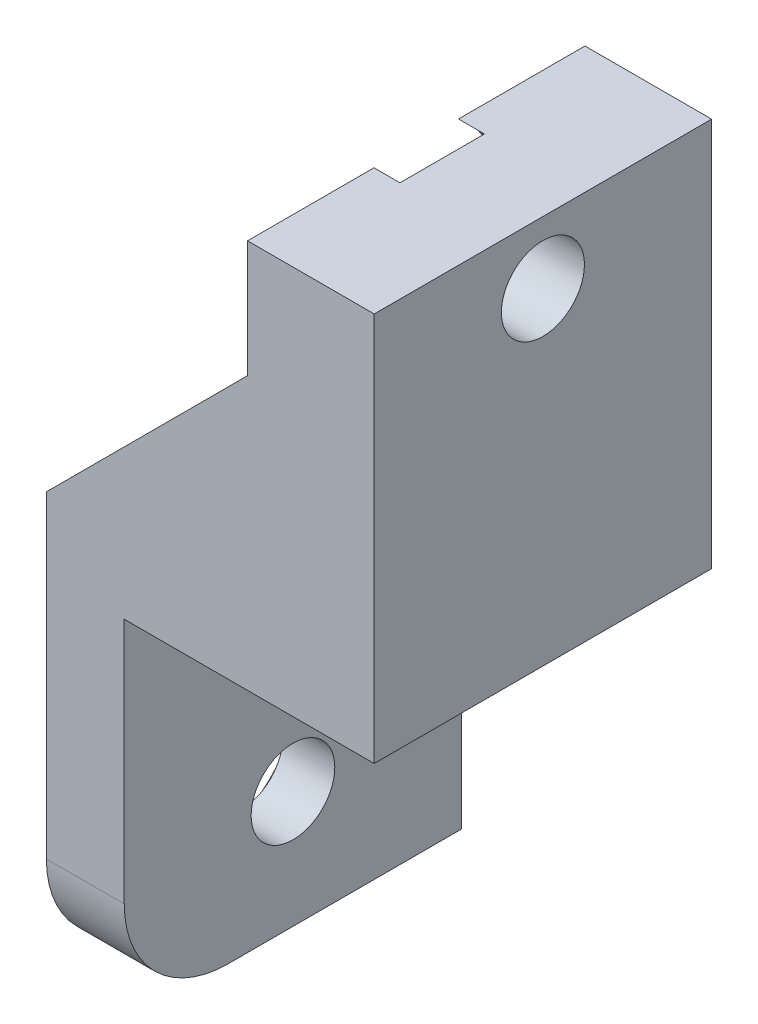
from build123d import *

# Parameters (mm, degrees)
BOSS_EXTRUDE1_DEPTH     = 13
CUT_EXTRUDE1_DEPTH      = 10
CUT_EXTRUDE1_DEPTH_BACK = 30
SKETCH2_R               = 1.6
SKETCH2_R_2             = 1.611537585
SKETCH3_R               = 3
CUT_EXTRUDE2_DEPTH      = 1
SKETCH4_R               = 2.9
CUT_EXTRUDE3_DEPTH      = 1
CHAMFER1_SIZE           = 10
FILLET1_R               = 4


with BuildPart() as part:
    # Sketch1 → Boss-Extrude1 (new body)
    with BuildSketch(Plane.XY.offset(98.171636097)):
        Polygon((30.334370899, 78.263460463), (35.214370899, 78.263460463), (35.214370899, 65.863460463), (35.214370899, 63.263460463), (25.584370899, 63.263460463), (25.584370899, 49.763460463), (22.584370899, 49.763460463), (22.584370899, 63.263460463), (22.584370899, 63.763460463), (30.334370899, 63.763460463), align=None)
    extrude(amount=-BOSS_EXTRUDE1_DEPTH)

    # Sketch2 → Cut-Extrude1 (cut, two sides: drawn at the far end of the back side and taken through both)
    with BuildSketch(Plane(origin=(35.214370899, 0, 0), x_dir=(0, 0, -1), z_dir=(1, 0, 0)).offset(-CUT_EXTRUDE1_DEPTH_BACK)):
        with Locations(Location((-91.671636097, 75.863460463, 0), (0, 0, 180))):
            Circle(SKETCH2_R)
        with Locations(Location((-91.671636097, 54.263460463, 0), (0, 0, 180))):
            Circle(SKETCH2_R_2)
    extrude(amount=CUT_EXTRUDE1_DEPTH + CUT_EXTRUDE1_DEPTH_BACK, mode=Mode.SUBTRACT)

    # Sketch3 → Cut-Extrude2 (cut)
    with BuildSketch(Plane.ZY.offset(-22.584370899)):
        with Locations((91.671636097, 54.263460463)):
            Circle(SKETCH3_R)
    extrude(amount=-CUT_EXTRUDE2_DEPTH, mode=Mode.SUBTRACT)

    # Sketch4 → Cut-Extrude3 (cut)
    with BuildSketch(Plane.ZY.offset(-30.334370899)):
        with Locations((91.671636097, 75.863460463)):
            Circle(SKETCH4_R)
    extrude(amount=-CUT_EXTRUDE3_DEPTH, mode=Mode.SUBTRACT)

    # Chamfer1
    # the kernel refuses this chamfer: 10 mm, written as the material it adds along each edge
    with BuildSketch(Plane(origin=(30.334370899, 63.763460463, 98.171636097), x_dir=(0.027495876610586337, 0.9996219169112968, 0), z_dir=(0, 0, -1))) as chamfer1_piece_1_section:
        Polygon((CHAMFER1_SIZE * 0.999621916911, -CHAMFER1_SIZE * 0.0274958766106), (-CHAMFER1_SIZE * 0.0274958766106, -CHAMFER1_SIZE * 0.999621916911), (0, 0), align=None)
    chamfer1_piece_1 = extrude(amount=13, mode=Mode.PRIVATE)
    chamfer1_piece_1 = chamfer1_piece_1 - Plane(origin=(27.388550815, 75.863460463, 91.671636097), x_dir=(0, 0, 1), z_dir=(-1, 0, 0)) * Cylinder(2.9, 66, mode=Mode.PRIVATE)
    chamfer1_piece_1 = split(chamfer1_piece_1, bisect_by=Plane(origin=(22.584370899, 67.23157259, 91.671636099), z_dir=(1, 0, 0)), keep=Keep.TOP, mode=Mode.PRIVATE)
    add(chamfer1_piece_1)

    # Fillet1
    fillet1_edges = [part.edges().sort_by_distance(p)[0] for p in [
        (24.084370899, 49.763460463, 98.171636097),
    ]]
    fillet(fillet1_edges, radius=FILLET1_R)


solid = part.part
